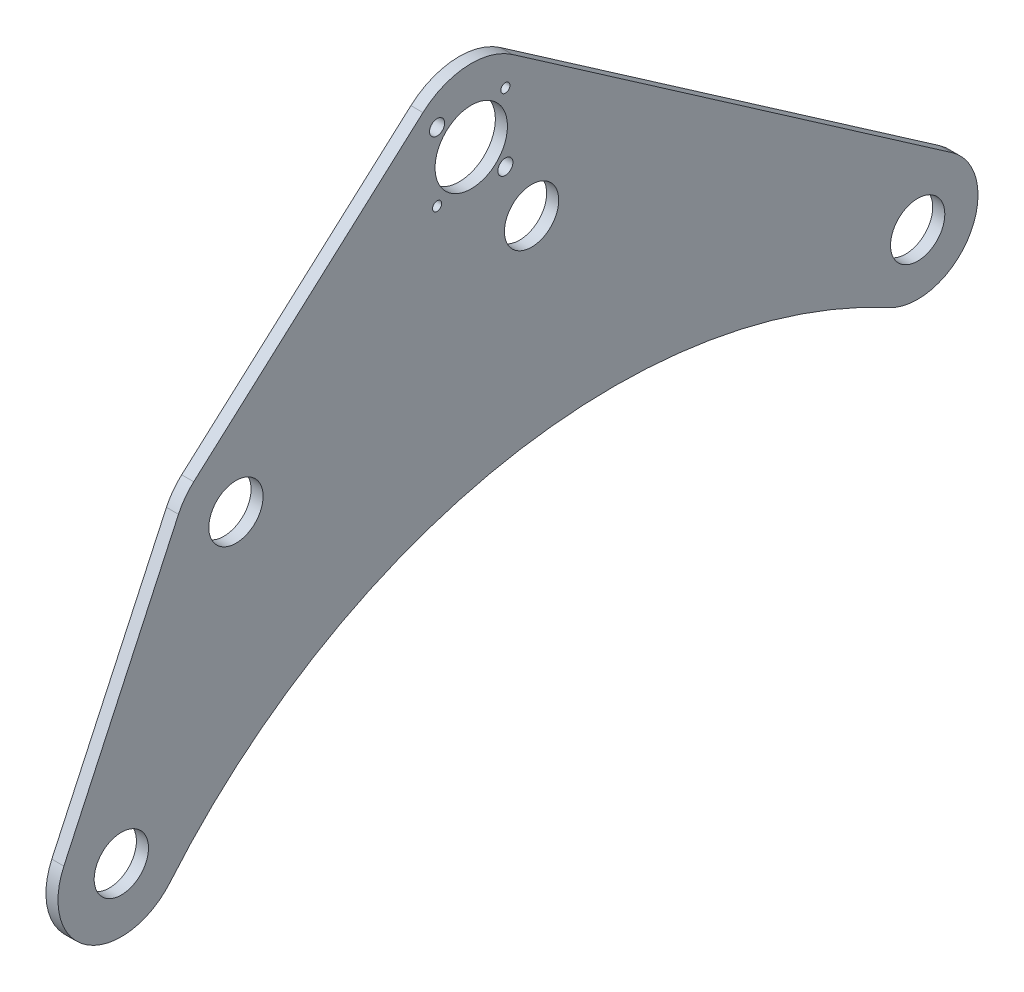
from build123d import *

# Parameters (mm, degrees)
BOSS_EXTRUDE1_DEPTH = 6.35
CUT_EXTRUDE1_REACH  = 494.039
SKETCH3_R           = 14.2875
SKETCH3_R_2         = 19.05
SKETCH3_R_3         = 2.413
SKETCH3_R_4         = 3.96875


with BuildPart() as part:
    # Sketch2 → Boss-Extrude1 (new body)
    with BuildSketch(Plane(origin=(0, 0, 0), x_dir=(0, 0, -1), z_dir=(1, 0, 0))):
        with BuildLine():
            Line((-449.347467345, -65.357880986), (-389.022467345, 64.817119014))
            ThreePointArc((-389.022467345, 64.817119014), (-385.565758877, 70.64046736), (-381.003559726, 75.645121025))
            Line((-381.003559726, 75.645121025), (-260.354068258, 183.588424029))
            ThreePointArc((-260.354068258, 183.588424029), (-237.302476246, 193.221304079), (-213.239358387, 186.503072818))
            Line((-213.239358387, 186.503072818), (18.092201344, 26.090894015))
            ThreePointArc((18.092201344, 26.090894015), (27.062234396, -16.604155188), (-15.064096059, -27.948801583))
            ThreePointArc((-15.064096059, -27.948801583), (-217.26171717, 3.054111034), (-393.523322923, -100.757761654))
            ThreePointArc((-393.523322923, -100.757761654), (-436.953345856, -107.52898636), (-449.347467345, -65.357880986))
        make_face()
    extrude(amount=BOSS_EXTRUDE1_DEPTH)

    # Sketch3 → Cut-Extrude1 (cut, up to next)
    with BuildSketch(Plane(origin=(6.35, 0, 0), x_dir=(0, 0, -1), z_dir=(1, 0, 0)), mode=Mode.PRIVATE) as cut_extrude1_sk1:
        with Locations((-203.2, 107.95)):
            Circle(SKETCH3_R)
    cut_extrude1_tool1 = extrude(cut_extrude1_sk1.sketch, amount=-CUT_EXTRUDE1_REACH, mode=Mode.PRIVATE) & part.part
    # Sketch3 → Cut-Extrude1 (cut, up to next)
    with BuildSketch(Plane(origin=(6.35, 0, 0), x_dir=(0, 0, -1), z_dir=(1, 0, 0)), mode=Mode.PRIVATE) as cut_extrude1_sk2:
        with Locations((-358.775, 50.8)):
            Circle(SKETCH3_R)
    cut_extrude1_tool2 = extrude(cut_extrude1_sk2.sketch, amount=-CUT_EXTRUDE1_REACH, mode=Mode.PRIVATE) & part.part
    # Sketch3 → Cut-Extrude1 (cut, up to next)
    with BuildSketch(Plane(origin=(6.35, 0, 0), x_dir=(0, 0, -1), z_dir=(1, 0, 0)), mode=Mode.PRIVATE) as cut_extrude1_sk3:
        with Locations((-419.1, -79.375)):
            Circle(SKETCH3_R)
    cut_extrude1_tool3 = extrude(cut_extrude1_sk3.sketch, amount=-CUT_EXTRUDE1_REACH, mode=Mode.PRIVATE) & part.part
    # Sketch3 → Cut-Extrude1 (cut, up to next)
    with BuildSketch(Plane(origin=(6.35, 0, 0), x_dir=(0, 0, -1), z_dir=(1, 0, 0)), mode=Mode.PRIVATE) as cut_extrude1_sk4:
        with Locations((-234.95, 155.194)):
            Circle(SKETCH3_R_2)
    cut_extrude1_tool4 = extrude(cut_extrude1_sk4.sketch, amount=-CUT_EXTRUDE1_REACH, mode=Mode.PRIVATE) & part.part
    # Sketch3 → Cut-Extrude1 (cut, up to next)
    with BuildSketch(Plane(origin=(6.35, 0, 0), x_dir=(0, 0, -1), z_dir=(1, 0, 0)), mode=Mode.PRIVATE) as cut_extrude1_sk5:
        Circle(SKETCH3_R)
    cut_extrude1_tool5 = extrude(cut_extrude1_sk5.sketch, amount=-CUT_EXTRUDE1_REACH, mode=Mode.PRIVATE) & part.part
    # Sketch3 → Cut-Extrude1 (cut, up to next)
    with BuildSketch(Plane(origin=(6.35, 0, 0), x_dir=(0, 0, -1), z_dir=(1, 0, 0)), mode=Mode.PRIVATE) as cut_extrude1_sk6:
        with Locations((-252.910512242, 137.233487758)):
            Circle(SKETCH3_R_3)
    cut_extrude1_tool6 = extrude(cut_extrude1_sk6.sketch, amount=-CUT_EXTRUDE1_REACH, mode=Mode.PRIVATE) & part.part
    # Sketch3 → Cut-Extrude1 (cut, up to next)
    with BuildSketch(Plane(origin=(6.35, 0, 0), x_dir=(0, 0, -1), z_dir=(1, 0, 0)), mode=Mode.PRIVATE) as cut_extrude1_sk7:
        with Locations((-216.989487758, 137.233487758)):
            Circle(SKETCH3_R_4)
    cut_extrude1_tool7 = extrude(cut_extrude1_sk7.sketch, amount=-CUT_EXTRUDE1_REACH, mode=Mode.PRIVATE) & part.part
    # Sketch3 → Cut-Extrude1 (cut, up to next)
    with BuildSketch(Plane(origin=(6.35, 0, 0), x_dir=(0, 0, -1), z_dir=(1, 0, 0)), mode=Mode.PRIVATE) as cut_extrude1_sk8:
        with Locations((-216.989487758, 173.154512242)):
            Circle(SKETCH3_R_3)
    cut_extrude1_tool8 = extrude(cut_extrude1_sk8.sketch, amount=-CUT_EXTRUDE1_REACH, mode=Mode.PRIVATE) & part.part
    # Sketch3 → Cut-Extrude1 (cut, up to next)
    with BuildSketch(Plane(origin=(6.35, 0, 0), x_dir=(0, 0, -1), z_dir=(1, 0, 0)), mode=Mode.PRIVATE) as cut_extrude1_sk9:
        with Locations((-252.910512242, 173.154512242)):
            Circle(SKETCH3_R_4)
    cut_extrude1_tool9 = extrude(cut_extrude1_sk9.sketch, amount=-CUT_EXTRUDE1_REACH, mode=Mode.PRIVATE) & part.part
    add(cut_extrude1_tool1.solids().sort_by_distance((6.35, 107.95, 203.2))[0], mode=Mode.SUBTRACT)
    add(cut_extrude1_tool2.solids().sort_by_distance((6.35, 50.8, 358.775))[0], mode=Mode.SUBTRACT)
    add(cut_extrude1_tool3.solids().sort_by_distance((6.35, -79.375, 419.1))[0], mode=Mode.SUBTRACT)
    add(cut_extrude1_tool4.solids().sort_by_distance((6.35, 155.194, 234.95))[0], mode=Mode.SUBTRACT)
    add(cut_extrude1_tool5.solids().sort_by_distance((6.35, 0, 0))[0], mode=Mode.SUBTRACT)
    add(cut_extrude1_tool6.solids().sort_by_distance((6.35, 137.233488, 252.910512))[0], mode=Mode.SUBTRACT)
    add(cut_extrude1_tool7.solids().sort_by_distance((6.35, 137.233488, 216.989488))[0], mode=Mode.SUBTRACT)
    add(cut_extrude1_tool8.solids().sort_by_distance((6.35, 173.154512, 216.989488))[0], mode=Mode.SUBTRACT)
    add(cut_extrude1_tool9.solids().sort_by_distance((6.35, 173.154512, 252.910512))[0], mode=Mode.SUBTRACT)


solid = part.part
